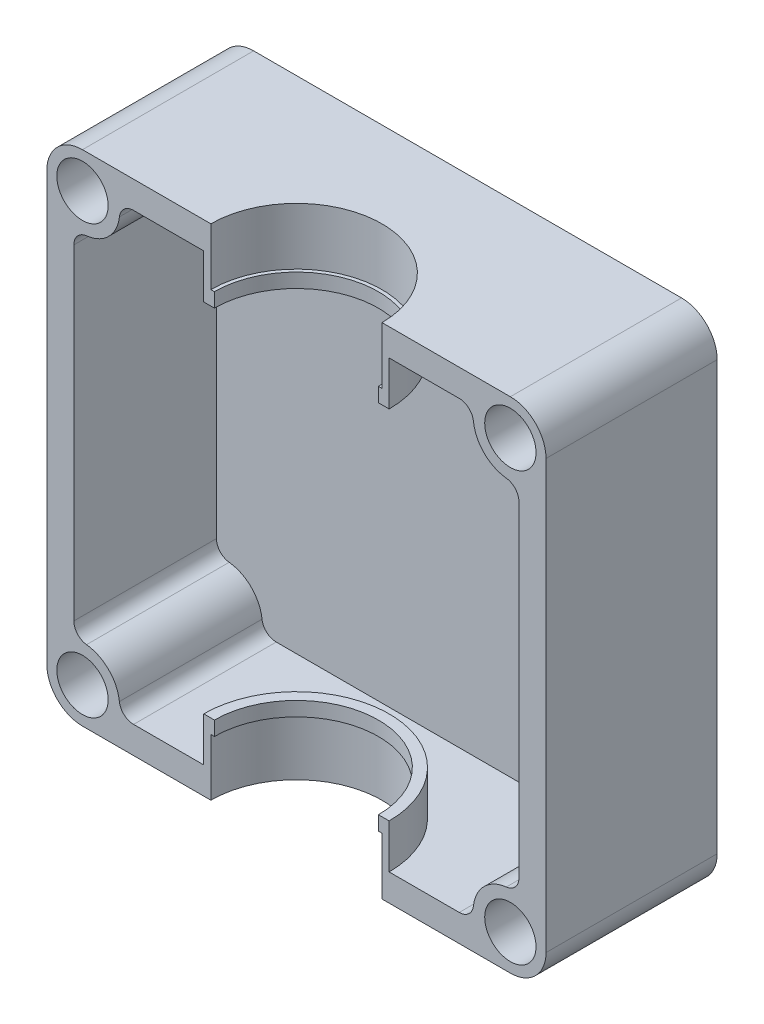
from build123d import *

# Parameters (mm, degrees)
SKETCH_1_R          = 1.8
EXTRUDE_1_DEPTH     = 42
CUT_EXTRUDE_1_DEPTH = 58.404268134
CUT_EXTRUDE_2_DEPTH = 58.404268134
CUT_EXTRUDE_3_DEPTH = 58.404268134
EXTRUDE_START       = 3.1
EXTRUDE_2_DEPTH     = 3.1
EXTRUDE_3_DEPTH     = 1
EXTRUDE_4_DEPTH     = 2


with BuildPart() as part:
    # 草图1 → 凸台-拉伸1 (new body)
    with BuildSketch(Plane(origin=(0, 0, 0), x_dir=(-1, 0, 0), z_dir=(0, 0, 1))):
        with BuildLine():
            Line((-17.5, 15), (-17.5, -15))
            ThreePointArc((-17.5, -15), (-16.767766953, -16.767766953), (-15, -17.5))
            Line((-15, -17.5), (15, -17.5))
            ThreePointArc((15, -17.5), (16.767766953, -16.767766953), (17.5, -15))
            Line((17.5, -15), (17.5, 15))
            ThreePointArc((17.5, 15), (16.767766953, 16.767766953), (15, 17.5))
            Line((15, 17.5), (-15, 17.5))
            ThreePointArc((-15, 17.5), (-16.767766953, 16.767766953), (-17.5, 15))
        make_face()
        with Locations((-15, -15)):
            Circle(SKETCH_1_R, mode=Mode.SUBTRACT)
        with Locations((15, -15)):
            Circle(SKETCH_1_R, mode=Mode.SUBTRACT)
        with Locations((15, 15)):
            Circle(SKETCH_1_R, mode=Mode.SUBTRACT)
        with Locations((-15, 15)):
            Circle(SKETCH_1_R, mode=Mode.SUBTRACT)
        with BuildLine():
            Line((15.604722414, -11.417049415), (15.604722414, 11.417049415))
            ThreePointArc((15.604722414, 11.417049415), (15.349600754, 12.084241863), (14.71440494, 12.410981979))
            ThreePointArc((14.71440494, 12.410981979), (13.158183899, 13.158182338), (12.410982221, 14.714402746))
            ThreePointArc((12.410982221, 14.714402746), (12.084242685, 15.349600017), (11.417049415, 15.604722414))
            Line((11.417049415, 15.604722414), (-11.417049415, 15.604722414))
            ThreePointArc((-11.417049415, 15.604722414), (-12.084241863, 15.349600754), (-12.410981979, 14.71440494))
            ThreePointArc((-12.410981979, 14.71440494), (-13.158182338, 13.158183899), (-14.714402746, 12.410982221))
            ThreePointArc((-14.714402746, 12.410982221), (-15.349600017, 12.084242685), (-15.604722413, 11.417049415))
            Line((-15.604722413, 11.417049415), (-15.604722413, -11.417049415))
            ThreePointArc((-15.604722413, -11.417049415), (-15.349600754, -12.084241863), (-14.71440494, -12.410981979))
            ThreePointArc((-14.71440494, -12.410981979), (-13.158183899, -13.158182338), (-12.410982221, -14.714402746))
            ThreePointArc((-12.410982221, -14.714402746), (-12.084242685, -15.349600017), (-11.417049415, -15.604722413))
            Line((-11.417049415, -15.604722413), (11.417049415, -15.604722413))
            ThreePointArc((11.417049415, -15.604722413), (12.084241863, -15.349600754), (12.410981979, -14.71440494))
            ThreePointArc((12.410981979, -14.71440494), (13.158182338, -13.158183899), (14.714402746, -12.410982221))
            ThreePointArc((14.714402746, -12.410982221), (15.349600017, -12.084242685), (15.604722414, -11.417049415))
        make_face(mode=Mode.SUBTRACT)
    extrude(amount=EXTRUDE_1_DEPTH)

    # 草图2 → 切除-拉伸1 (cut, through all)
    with BuildSketch(Plane(origin=(0, 17.5, 0), x_dir=(1, 0, 0), z_dir=(0, 1, 0))):
        with BuildLine():
            ThreePointArc((0, -6), (-4.242640687, -16.242640687), (6, -12))
            ThreePointArc((6, -12), (4.242640687, -7.757359313), (0, -6))
        make_face()
    extrude(amount=-CUT_EXTRUDE_1_DEPTH, mode=Mode.SUBTRACT)

    # 草图3 → 切除-拉伸2 (cut, through all)
    with BuildSketch(Plane.ZY.offset(17.5)):
        with BuildLine():
            ThreePointArc((24, 0), (30, -6), (36, 0))
            ThreePointArc((36, 0), (30, 6), (24, 0))
        make_face()
    extrude(amount=-CUT_EXTRUDE_2_DEPTH, mode=Mode.SUBTRACT)

    # 草图4 → 切除-拉伸3 (cut, through all)
    with BuildSketch(Plane(origin=(0, 17.5, 0), x_dir=(1, 0, 0), z_dir=(0, 1, 0))):
        Polygon((6, -12), (-20.697850439, -12), (-20.697850439, -44.893188011), (22.086830154, -44.893188011), (22.086830154, -12), align=None)
    extrude(amount=-CUT_EXTRUDE_3_DEPTH, mode=Mode.SUBTRACT)

    # 草图5 → 凸台-拉伸2 (add)
    with BuildSketch(Plane(origin=(0, -15.604722414, 0), x_dir=(1, 0, 0), z_dir=(0, 1, 0)).offset(EXTRUDE_START)):
        with BuildLine():
            Line((-6, -12), (-6.5, -12))
            ThreePointArc((-6.5, -12), (0, -5.5), (6.5, -12))
            Line((6.5, -12), (6, -12))
            ThreePointArc((6, -12), (0, -6), (-6, -12))
        make_face()
    extrude_2 = extrude(amount=-EXTRUDE_2_DEPTH)

    # 草图7 → 凸台-拉伸3 (add)
    with BuildSketch(Plane(origin=(0, -12.504722414, 0), x_dir=(1, 0, 0), z_dir=(0, 1, 0))):
        with BuildLine():
            Line((6.5, -12), (5.75, -12))
            ThreePointArc((5.75, -12), (0, -6.25), (-5.75, -12))
            Line((-5.75, -12), (-6.5, -12))
            ThreePointArc((-6.5, -12), (0, -5.5), (6.5, -12))
        make_face()
    extrude_3 = extrude(amount=-EXTRUDE_3_DEPTH)

    # 镜向2: 凸台-拉伸2, 凸台-拉伸3 across plane
    add(extrude_2.mirror(Plane.ZX))
    add(extrude_3.mirror(Plane.ZX))

    # 草图8 → 凸台-拉伸4 (add)
    with BuildSketch(Plane(origin=(0, 0, 0), x_dir=(-1, 0, 0), z_dir=(0, 0, -1))):
        with BuildLine():
            Line((-11.417049415, -15.604722414), (11.417049415, -15.604722414))
            ThreePointArc((11.417049415, -15.604722414), (12.084242685, -15.349600017), (12.410982221, -14.714402746))
            ThreePointArc((12.410982221, -14.714402746), (13.158183899, -13.158182338), (14.71440494, -12.410981979))
            ThreePointArc((14.71440494, -12.410981979), (15.349600754, -12.084241863), (15.604722414, -11.417049415))
            Line((15.604722414, -11.417049415), (15.604722414, 11.417049415))
            ThreePointArc((15.604722414, 11.417049415), (15.349600017, 12.084242685), (14.714402746, 12.410982221))
            ThreePointArc((14.714402746, 12.410982221), (13.158182338, 13.158183899), (12.410981979, 14.71440494))
            ThreePointArc((12.410981979, 14.71440494), (12.084241863, 15.349600754), (11.417049415, 15.604722413))
            Line((11.417049415, 15.604722413), (-11.417049415, 15.604722413))
            ThreePointArc((-11.417049415, 15.604722413), (-12.084242685, 15.349600017), (-12.410982221, 14.714402746))
            ThreePointArc((-12.410982221, 14.714402746), (-13.158183899, 13.158182338), (-14.71440494, 12.410981979))
            ThreePointArc((-14.71440494, 12.410981979), (-15.349600754, 12.084241863), (-15.604722413, 11.417049415))
            Line((-15.604722413, 11.417049415), (-15.604722413, -11.417049415))
            ThreePointArc((-15.604722413, -11.417049415), (-15.349600017, -12.084242685), (-14.714402746, -12.410982221))
            ThreePointArc((-14.714402746, -12.410982221), (-13.158182338, -13.158183899), (-12.410981979, -14.71440494))
            ThreePointArc((-12.410981979, -14.71440494), (-12.084241863, -15.349600754), (-11.417049415, -15.604722414))
        make_face()
    extrude(amount=-EXTRUDE_4_DEPTH)


solid = part.part
